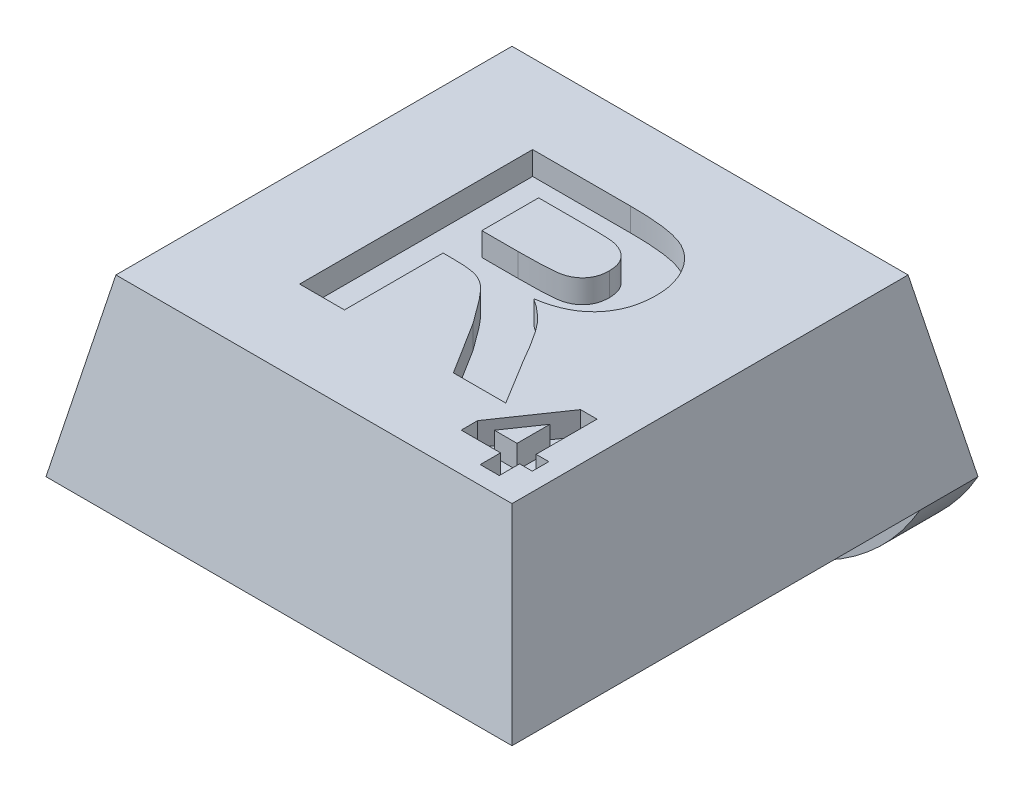
from build123d import *

# Parameters (mm, degrees)
SKETCH1_W               = 8
SKETCH1_H               = 8
BOSS_EXTRUDE1_DEPTH     = 3
CUT_EXTRUDE1_DEPTH      = 12.704699911
CUT_EXTRUDE1_DEPTH_BACK = 12.704699911
CUT_EXTRUDE2_DEPTH      = 11
SKETCH4_R               = 1.8
CUT_EXTRUDE3_DEPTH      = 0.8
SKETCH5_W               = 8
SKETCH5_H               = 1
BOSS_EXTRUDE2_DEPTH     = 2
FILLET1_R               = 4
CUT_EXTRUDE4_DEPTH      = 0.4
CUT_EXTRUDE5_DEPTH      = 0.4


with BuildPart() as part:
    # Sketch1 → Boss-Extrude1 (new body)
    with BuildSketch(Plane(origin=(0, 0, 0), x_dir=(1, 0, 0), z_dir=(0, 1, 0))):
        with Locations((4, 4)):
            Rectangle(SKETCH1_W, SKETCH1_H)
    extrude(amount=BOSS_EXTRUDE1_DEPTH)

    # Sketch2 → Cut-Extrude1 (cut, two sides: drawn at the far end of the back side and taken through both)
    with BuildSketch(Plane.XY.offset(-CUT_EXTRUDE1_DEPTH_BACK)):
        Polygon((0, 0), (0.6, 3), (0, 3), align=None)
        Polygon((8, 0), (7.4, 3), (8, 3), align=None)
    extrude(amount=CUT_EXTRUDE1_DEPTH + CUT_EXTRUDE1_DEPTH_BACK, mode=Mode.SUBTRACT)

    # Sketch3 → Cut-Extrude2 (cut)
    with BuildSketch(Plane(origin=(0, 0, 0), x_dir=(0, 0, -1), z_dir=(1, 0, 0))):
        Polygon((0, 0), (0.6, 3), (0, 3), align=None)
        Polygon((8, 3), (7.4, 3), (8, 0), align=None)
    extrude(amount=CUT_EXTRUDE2_DEPTH, mode=Mode.SUBTRACT)

    # Sketch4 → Cut-Extrude3 (cut)
    with BuildSketch(Plane.XZ):
        with Locations(Location((4, -3.75, 0), (0, 0, 270))):
            Circle(SKETCH4_R)
    extrude(amount=-CUT_EXTRUDE3_DEPTH, mode=Mode.SUBTRACT)

    # Sketch5 → Boss-Extrude2 (add)
    with BuildSketch(Plane.XZ):
        with Locations((4, -7.5)):
            Rectangle(SKETCH5_W, SKETCH5_H)
    extrude(amount=BOSS_EXTRUDE2_DEPTH)

    # Fillet1
    # the kernel refuses this fillet: 4 mm, written as the material it takes off along each edge
    with BuildSketch(Plane(origin=(8, -2, -16.660254038), x_dir=(0, 1, 0), z_dir=(0, 0, 1)), Plane(origin=(0, -2, 1.660254038), x_dir=(0, 1, 0), z_dir=(0, 0, -1))) as fillet1_piece_1:
        with BuildLine():
            CenterArc((4, 3.464101615), FILLET1_R, 180, 60)
            Line((0, 3.464101615), (-0.08, 3.464101615))
            Line((-0.08, 3.464101615), (-0.08, 0))
            Line((-0.08, 0), (0, -0.08))
            ThreePointArc((0, -0.08), (1, -0.08), (1.96, -0.069282032))
            Line((1.96, -0.069282032), (2, 0))
        make_face()
    extrude(amount=18.320508076, mode=Mode.SUBTRACT)

    # Sketch6 → Cut-Extrude4 (cut)
    with BuildSketch(Plane(origin=(0, 3, 0), x_dir=(1, 0, 0), z_dir=(0, 1, 0))):
        with BuildLine():
            Line((2.312898911, 2.041410717), (2.312898911, 6.041410717))
            Line((2.312898911, 6.041410717), (3.991584808, 6.041410717))
            add(Edge.make_bspline(
                [(3.991584808, 6.041410717), (4.042601732, 6.041096301), (4.140920681, 6.040490364), (4.283109063, 6.036071747), (4.414238667, 6.026814487), (4.534891188, 6.016330564), (4.644487122, 6.001077132), (4.74345979, 5.982803671), (4.831642566, 5.961627249), (4.910322089, 5.936265049), (4.982061831, 5.90723713), (5.04889092, 5.87268574), (5.111544162, 5.83220454), (5.170983849, 5.787188805), (5.227461685, 5.737569368), (5.279429347, 5.682033053), (5.32779225, 5.621406813), (5.372511371, 5.556195062), (5.411906117, 5.48668575), (5.447902572, 5.415111184), (5.477205044, 5.340709703), (5.50140862, 5.263831792), (5.52074281, 5.184644366), (5.534162371, 5.102946099), (5.542540058, 5.018884869), (5.543287935, 4.962103945), (5.543668142, 4.93323764)],
                knots=[0, 0, 0, 0, 1.675828044, 3.229627355, 4.67171229, 5.993455049, 7.206927059, 8.304770529, 9.29850117, 10.183580433, 11.017754134, 11.837875825, 12.650738409, 13.464925643, 14.285328857, 15.117007378, 15.959673368, 16.830859064, 17.711229498, 18.58228265, 19.460420693, 20.334473227, 21.228207035, 22.135446768, 23.052097822, 24, 24, 24, 24], degree=3))
            add(Edge.make_bspline(
                [(5.543668142, 4.93323764), (5.542962916, 4.896874176), (5.541584712, 4.825809944), (5.528901745, 4.721651895), (5.5100643, 4.622136315), (5.483211668, 4.527125334), (5.446289845, 4.437736414), (5.403428122, 4.352717347), (5.352308317, 4.272356517), (5.293277733, 4.19745058), (5.226389218, 4.127933229), (5.151349641, 4.065235076), (5.06869476, 4.009111084), (4.977924564, 3.959884897), (4.879671091, 3.917801842), (4.77350828, 3.882394441), (4.659916733, 3.853576761), (4.580902516, 3.840017181), (4.540463013, 3.833077384)],
                knots=[0, 0, 0, 0, 1.05911256, 2.069797862, 3.05271628, 4.008392045, 4.940519534, 5.866323021, 6.779546087, 7.71056835, 8.640711998, 9.585328432, 10.554502533, 11.547017206, 12.589327225, 13.664782803, 14.804835066, 16, 16, 16, 16], degree=3))
            add(Edge.make_bspline(
                [(4.540463013, 3.833077384), (4.579572554, 3.807174767), (4.656115253, 3.756479818), (4.762017587, 3.672984601), (4.857092756, 3.585349912), (4.929078878, 3.507419696), (4.984392794, 3.438888442), (5.028929947, 3.378950347), (5.076970406, 3.309970293), (5.128042999, 3.231910907), (5.183657562, 3.145462828), (5.241745689, 3.049302835), (5.303522957, 2.944368887), (5.345058377, 2.871067212), (5.366584808, 2.833077384)],
                knots=[0, 0, 0, 0, 1.285445069, 2.515791127, 3.691898215, 4.826622834, 5.420063933, 6.105349801, 6.873086501, 7.723915395, 8.66222816, 9.690593598, 10.803111229, 12, 12, 12, 12], degree=3))
            Line((5.366584808, 2.833077384), (5.851360449, 2.041410717))
            Line((5.851360449, 2.041410717), (4.952321988, 2.041410717))
            Line((4.952321988, 2.041410717), (4.383411731, 2.949263281))
            add(Edge.make_bspline(
                [(4.383411731, 2.949263281), (4.357283981, 2.985622121), (4.307400733, 3.055038622), (4.235391184, 3.153681722), (4.169508837, 3.241491798), (4.111507042, 3.319740728), (4.058450932, 3.386209972), (4.011951502, 3.442057857), (3.972955886, 3.488482798), (3.928832249, 3.534515131), (3.877499082, 3.581823547), (3.813952721, 3.627691749), (3.748696505, 3.664257396), (3.678779681, 3.692157844), (3.597922987, 3.71161189), (3.500720436, 3.724006591), (3.384115753, 3.733151261), (3.299833928, 3.733519777), (3.254405321, 3.73371841)],
                knots=[0, 0, 0, 0, 1.465447777, 2.797841088, 3.997266218, 5.05856206, 5.985598736, 6.780315439, 7.437430484, 7.969193402, 8.866571936, 9.718200644, 10.52825214, 11.309096006, 12.174169268, 13.242355782, 14.513606761, 16, 16, 16, 16], degree=3))
            Line((3.254405321, 3.73371841), (3.08212968, 3.73371841))
            Line((3.08212968, 3.73371841), (3.08212968, 2.041410717))
            Line((3.08212968, 2.041410717), (2.312898911, 2.041410717))
        make_face()
        with BuildLine():
            Line((3.08212968, 4.400385076), (3.701520706, 4.400385076))
            add(Edge.make_bspline(
                [(3.701520706, 4.400385076), (3.749332843, 4.400487541), (3.840423044, 4.400682752), (3.969955122, 4.403510317), (4.085670885, 4.405910235), (4.186877859, 4.411940131), (4.274028855, 4.417916326), (4.346774263, 4.425683211), (4.405726987, 4.434863419), (4.464610849, 4.449136231), (4.52492793, 4.474003789), (4.589214527, 4.509422512), (4.644158691, 4.555370201), (4.691753027, 4.608490376), (4.728060837, 4.670937972), (4.756498441, 4.739930879), (4.770916908, 4.817002181), (4.773239296, 4.87042263), (4.774437372, 4.89798123)],
                knots=[0, 0, 0, 0, 1.697953026, 3.23488743, 4.60134403, 5.807846676, 6.835100678, 7.703488618, 8.405232423, 8.952775585, 9.851109663, 10.713519226, 11.549115941, 12.382556273, 13.233359028, 14.101746968, 15.020727134, 16, 16, 16, 16], degree=3))
            add(Edge.make_bspline(
                [(4.774437372, 4.89798123), (4.773074786, 4.928811222), (4.770445895, 4.98829272), (4.749714088, 5.072935459), (4.713527564, 5.147705664), (4.663829732, 5.212726785), (4.601441933, 5.267631557), (4.527131165, 5.311213996), (4.441449505, 5.343672387), (4.379650359, 5.355659208), (4.347354039, 5.361923538)],
                knots=[0, 0, 0, 0, 1.062977961, 2.050844577, 2.982300261, 3.90936959, 4.856017476, 5.831122378, 6.86654153, 8, 8, 8, 8], degree=3))
            add(Edge.make_bspline(
                [(4.347354039, 5.361923538), (4.336678458, 5.363096555), (4.311375089, 5.365876852), (4.266692338, 5.367662514), (4.20955971, 5.370407271), (4.139285669, 5.371528992), (4.056498042, 5.373495271), (3.960867626, 5.373856329), (3.852698247, 5.375009885), (3.776307493, 5.374835906), (3.735975834, 5.374744051)],
                knots=[0, 0, 0, 0, 0.42127143, 0.998501726, 1.753681744, 2.66564073, 3.755712164, 5.002818897, 6.417592707, 8, 8, 8, 8], degree=3))
            Line((3.735975834, 5.374744051), (3.08212968, 5.374744051))
            Line((3.08212968, 5.374744051), (3.08212968, 4.400385076))
        make_face(mode=Mode.SUBTRACT)
    extrude(amount=-CUT_EXTRUDE4_DEPTH, mode=Mode.SUBTRACT)

    # Sketch7 → Cut-Extrude5 (cut)
    with BuildSketch(Plane(origin=(0, 3, 0), x_dir=(1, 0, 0), z_dir=(0, 1, 0))):
        Polygon((6.546707708, 0.907912363), (6.546707708, 1.256630312), (5.871066683, 1.256630312), (5.871066683, 1.53894201), (6.589956907, 2.586117491), (6.873630785, 2.586117491), (6.873630785, 1.539963645), (7.091579503, 1.539963645), (7.091579503, 1.256630312), (6.873630785, 1.256630312), (6.873630785, 0.907912363), align=None)
        Polygon((6.546707708, 1.539963645), (6.546707708, 2.105949222), (6.157805465, 1.539963645), align=None, mode=Mode.SUBTRACT)
    extrude(amount=-CUT_EXTRUDE5_DEPTH, mode=Mode.SUBTRACT)


solid = part.part
